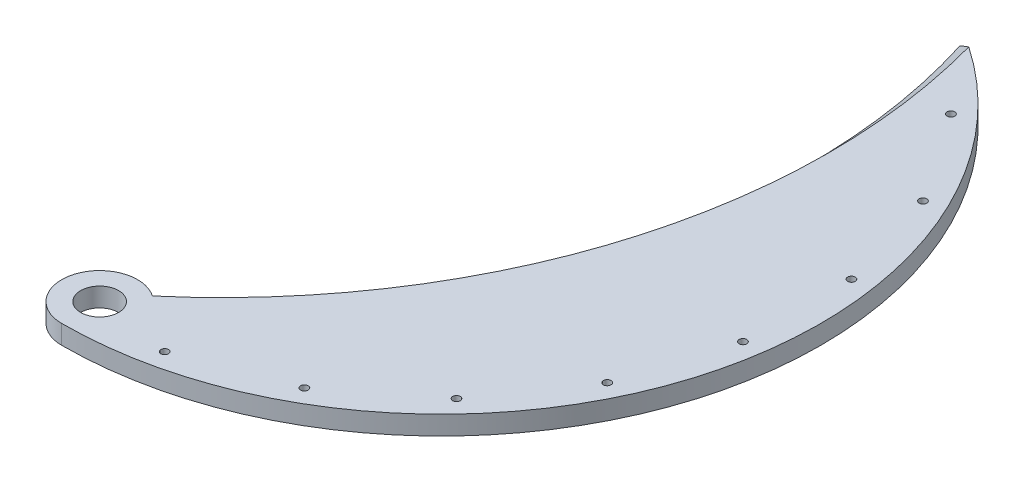
from build123d import *

# Parameters (mm, degrees)
IZIM1_R                     = 10
IZIM1_R_2                   = 5
Y_KSEKLIK_EKSTR_ZYON1_DEPTH = 5
PAH1_SIZE                   = 5
IZIM2_R                     = 1
KANCA_DELIKLERI_DEPTH       = 204.010978335


with BuildPart() as part:
    # Çizim1 → Yükseklik-Ekstrüzyon1 (new body)
    # profile 1 of 2: a face of its own
    with BuildSketch(Plane(origin=(0, 0, 0), x_dir=(1, 0, 0), z_dir=(0, 1, 0))):
        Circle(IZIM1_R)
        with Locations(Location((0, 0, 0), (0, 0, 270))):
            Circle(IZIM1_R_2, mode=Mode.SUBTRACT)
    # profile 2 of 2: a face of its own
    with BuildSketch(Plane(origin=(0, 0, 0), x_dir=(1, 0, 0), z_dir=(0, 1, 0))):
        with BuildLine():
            ThreePointArc((2.57e-07, -10), (96.592582662, 64.118095614), (50, 176.602540378))
            ThreePointArc((50, 176.602540378), (50.573117628, 85.626381928), (0, 10))
            ThreePointArc((0, 10), (7.071067812, 7.071067812), (10, 0))
            ThreePointArc((10, 0), (7.071067903, -7.071067721), (2.57e-07, -10))
        make_face()
    extrude(amount=Y_KSEKLIK_EKSTR_ZYON1_DEPTH)

    # Pah1
    pah1_edges = [part.edges().sort_by_distance(p)[0] for p in [
        (50.573117628, 5, -85.626381928),
    ]]
    chamfer(pah1_edges, length=PAH1_SIZE - 0.0001)  # a hair under: the kernel refuses the full size

    # Çizim2 → kanca delikleri (cut, through all)
    with BuildSketch(Plane(origin=(0, 5, 0), x_dir=(1, 0, 0), z_dir=(0, 1, 0))):
        with Locations(Location((69.348523033, 154.929056309, 0), (0, 0, 270))):
            Circle(IZIM2_R)
        with Locations(Location((85.505252147, 131.398693884, 0), (0, 0, 270))):
            Circle(IZIM2_R)
        with Locations(Location((93.943127486, 104.131128696, 0), (0, 0, 270))):
            Circle(IZIM2_R)
        with Locations(Location((93.900432964, 75.587897823, 0), (0, 0, 270))):
            Circle(IZIM2_R)
        with Locations(Location((85.381022764, 48.345697079, 0), (0, 0, 270))):
            Circle(IZIM2_R)
        with Locations(Location((69.153973403, 24.863773807, 0), (0, 0, 270))):
            Circle(IZIM2_R)
        with Locations(Location((46.684156547, 7.261922143, 0), (0, 0, 270))):
            Circle(IZIM2_R)
        with Locations(Location((20, -2.870878105, 0), (0, 0, 270))):
            Circle(IZIM2_R)
    extrude(amount=-KANCA_DELIKLERI_DEPTH, mode=Mode.SUBTRACT)


solid = part.part
